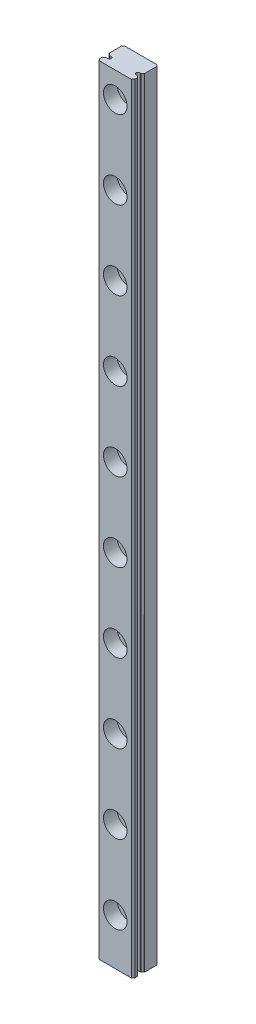
from build123d import *

# Parameters (mm, degrees)
RESSALTO_EXTRUS_O1_DEPTH                             = 1000
CORTE_EXTRUS_O1_START                                = -1000
CORTE_EXTRUS_O1_DEPTH                                = 1000
CORTE_EXTRUS_O2_DEPTH                                = 1001.031261626
CORTE_EXTRUS_O3_DEPTH                                = 1001.031261626
CORTE_EXTRUS_O4_DEPTH                                = 1001.031261626
CORTE_EXTRUS_O5_DEPTH                                = 0.002166667
CORTE_EXTRUS_O6_DEPTH                                = 0.002166667
CORTE_EXTRUS_O7_DEPTH                                = 0.002166667
CORTE_EXTRUS_O8_DEPTH                                = 0.002166667
INCLINA_O1_ANGLE                                     = 45.1469538
ESBO_O10_W                                           = 0.450000001
ESBO_O10_H                                           = 1000
REBAIXO_PARA_PARAFUSO_DE_M_QUINA_DE_CABE_D           = 3.5
REBAIXO_PARA_PARAFUSO_DE_M_QUINA_DE_CABE_CBORE_D     = 6
REBAIXO_PARA_PARAFUSO_DE_M_QUINA_DE_CABE_CBORE_DEPTH = 3.50000002
CHANFRO1_SIZE                                        = 0.062563219
CHANFRO1_SIZE2                                       = 0.062205617
CHANFRO3_START                                       = -3.730761794
CHANFRO3_DEPTH                                       = 0.399013115
CHANFRO4_SIZE                                        = 0.4
FILETE1_R                                            = 0.130000023
SKETCH1_W                                            = 36.072768502
SKETCH1_H                                            = 801.847062841
SKETCH1_W_2                                          = 21.632087489
SKETCH1_H_2                                          = 62.411000867
CUT_EXTRUDE1_DEPTH                                   = 10


with BuildPart() as part:
    # Esboço1 → Ressalto-extrusão1 (new body)
    with BuildSketch(Plane.XZ):
        with BuildLine():
            Line((4.5, 5.4097155), (4.5, 6.01167813))
            Line((4.5, 6.01167813), (4.1, 6.50000002))
            Line((4.1, 6.50000002), (-4.1, 6.50000002))
            Line((-4.1, 6.50000002), (-4.5, 6.01167813))
            Line((-4.5, 6.01167813), (-4.5, 2e-08))
            Line((-4.5, 2e-08), (4.5, 2e-08))
            Line((4.5, 2e-08), (4.5, 3.50196265))
            ThreePointArc((4.5, 3.50196265), (4.477413879, 3.553810372), (4.43494978, 3.59116167))
            ThreePointArc((4.43494978, 3.59116167), (3.930462682, 4.43021964), (4.43494978, 5.26927761))
            ThreePointArc((4.43494978, 5.26927761), (4.490651601, 5.328761203), (4.5, 5.4097155))
        make_face()
    extrude(amount=-RESSALTO_EXTRUS_O1_DEPTH)

    # Esboço2 → Corte-extrusão1 (cut)
    with BuildSketch(Plane(origin=(0, 1000, 0), x_dir=(-1, 0, 0), z_dir=(0, 1, 0)).offset(CORTE_EXTRUS_O1_START)):
        with BuildLine():
            Line((-4.030498711, 4.00588336), (-3.673447948, 4.00588336))
            ThreePointArc((-3.673447948, 4.00588336), (-3.223447946, 4.455883362), (-3.673447948, 4.905883363))
            Line((-3.673447948, 4.905883363), (-3.953580008, 4.905883363))
            ThreePointArc((-3.953580008, 4.905883363), (-4.010719931, 4.899199784), (-4.065149208, 4.917830263))
            ThreePointArc((-4.065149208, 4.917830263), (-3.93114763, 4.466290066), (-4.030498711, 4.00588336))
        make_face()
    extrude(amount=CORTE_EXTRUS_O1_DEPTH, mode=Mode.SUBTRACT)

    # Esboço3 → Corte-extrusão2 (cut, through all)
    with BuildSketch(Plane(origin=(0, 1000, 0), x_dir=(-1, 0, 0), z_dir=(0, 1, 0))):
        with BuildLine():
            Line((4.5, 4.03150278), (4.5, 4.88017535))
            Line((4.5, 4.88017535), (3.66946318, 4.88017535))
            ThreePointArc((3.66946318, 4.88017535), (3.969667593, 4.455839065), (3.66946318, 4.03150278))
            Line((3.66946318, 4.03150278), (4.5, 4.03150278))
        make_face()
    extrude(amount=-CORTE_EXTRUS_O2_DEPTH, mode=Mode.SUBTRACT)

    # Esboço4 → Corte-extrusão3 (cut, through all)
    with BuildSketch(Plane(origin=(0, 1000, 0), x_dir=(-1, 0, 0), z_dir=(0, 1, 0))):
        with BuildLine():
            Line((4.026513974, 4.88017535), (4.5, 4.88017535))
            Line((4.5, 4.88017535), (4.5, 5.328056964))
            ThreePointArc((4.5, 5.328056964), (4.223646078, 5.145991535), (4.026513974, 4.88017535))
        make_face()
    extrude(amount=-CORTE_EXTRUS_O3_DEPTH, mode=Mode.SUBTRACT)

    # Esboço5 → Corte-extrusão4 (cut, through all)
    with BuildSketch(Plane(origin=(0, 1000, 0), x_dir=(-1, 0, 0), z_dir=(0, 1, 0))):
        with BuildLine():
            Line((4.5, 3.583620931), (4.5, 4.03150278))
            Line((4.5, 4.03150278), (4.026513856, 4.03150278))
            ThreePointArc((4.026513856, 4.03150278), (4.223645982, 3.76568645), (4.5, 3.583620931))
        make_face()
    extrude(amount=-CORTE_EXTRUS_O4_DEPTH, mode=Mode.SUBTRACT)

    # Esboço6 → Corte-extrusão5 (cut)
    with BuildSketch(Plane(origin=(0, 1000, 0), x_dir=(-1, 0, 0), z_dir=(0, 1, 0))):
        Polygon((0.891369267, 3.403698133), (0.714701433, 3.168235633), (0.2187042, 2.61105), (1.0945792, 2.61105), (1.0945792, 2.695983333), (0.398689633, 2.695983333), (0.794326433, 3.149466667), (0.9743123, 3.3891), (1.067110588, 3.573407857), (0.95413722, 3.802321701), (0.7876908, 3.88505), (0.54301, 3.88505), (0.375434678, 3.803592619), (0.295011167, 3.6384023), (0.295011167, 3.562), (0.3812718, 3.562), (0.3812718, 3.631766667), (0.437672733, 3.743620833), (0.549645633, 3.800116667), (0.7802262, 3.800116667), (0.893028067, 3.743810633), (0.976240026, 3.576039029), align=None)
    extrude(amount=-CORTE_EXTRUS_O5_DEPTH, mode=Mode.SUBTRACT)

    # Esboço7 → Corte-extrusão6 (cut)
    with BuildSketch(Plane.XZ):
        Polygon((-0.214632167, 3.88505), (-0.953983333, 3.88505), (-0.953983333, 2.61105), (-0.214632167, 2.61105), (-0.214632167, 2.695983333), (-0.86905, 2.695983333), (-0.86905, 3.205583333), (-0.5123963, 3.205583333), (-0.5123963, 3.290516667), (-0.86905, 3.290516667), (-0.86905, 3.800116667), (-0.214632167, 3.800116667), align=None)
    extrude(amount=-CORTE_EXTRUS_O6_DEPTH, mode=Mode.SUBTRACT)

    # Esboço8 → Corte-extrusão7 (cut)
    with BuildSketch(Plane(origin=(0, 1000, 0), x_dir=(-1, 0, 0), z_dir=(0, 1, 0))):
        Polygon((-0.214632167, 3.88505), (-0.953983333, 3.88505), (-0.953983333, 2.61105), (-0.214632167, 2.61105), (-0.214632167, 2.695983333), (-0.86905, 2.695983333), (-0.86905, 3.205583333), (-0.5123963, 3.205583333), (-0.5123963, 3.290516667), (-0.86905, 3.290516667), (-0.86905, 3.800116667), (-0.214632167, 3.800116667), align=None)
    extrude(amount=-CORTE_EXTRUS_O7_DEPTH, mode=Mode.SUBTRACT)

    # Esboço9 → Corte-extrusão8 (cut)
    with BuildSketch(Plane.XZ):
        Polygon((0.510057167, 3.620830633), (0.6071, 3.718655633), (0.6071, 2.609403333), (0.692033333, 2.609403333), (0.692033333, 3.883403333), (0.6741176, 3.883403333), (0.6741176, 3.795069794), (0.3690544, 3.640736667), (0.3690544, 3.551253333), align=None)
    extrude(amount=-CORTE_EXTRUS_O8_DEPTH, mode=Mode.SUBTRACT)

    # Inclinação1
    inclina_o1_faces = [part.faces().sort_by_distance(p)[0] for p in [
        (0.6741176, 0.001083333, 3.839236564),
    ]]
    draft(inclina_o1_faces, Plane(origin=(0.692033333, 0.002166667, 3.883403333), x_dir=(-1, 0, 0), z_dir=(0, 0, -1)), INCLINA_O1_ANGLE)

    # Esboço10 → Corte-Revolução1 (revolve, cut)
    with BuildSketch(Plane.XY.offset(4.455839065)):
        with Locations((-3.294667591, 500)):
            Rectangle(ESBO_O10_W, ESBO_O10_H)
    revolve(axis=Axis((-3.519667591, 1000, 4.455839065), (0, -1, 0)), mode=Mode.SUBTRACT)

    # Rebaixo para parafuso de máquina de cabeça sextavada de M31 (through all)
    with Locations(Plane.XY.offset(6.50000002)):
        with Locations((0, 990), (0, 970), (0, 950), (0, 930), (0, 910), (0, 890), (0, 870), (0, 850), (0, 830), (0, 810), (0, 790), (0, 770), (0, 750), (0, 730), (0, 710), (0, 690), (0, 670), (0, 650), (0, 630), (0, 610), (0, 590), (0, 570), (0, 550), (0, 530), (0, 510), (0, 490), (0, 470), (0, 450), (0, 430), (0, 410), (0, 390), (0, 370), (0, 350), (0, 330), (0, 310), (0, 290), (0, 270), (0, 250), (0, 230), (0, 210), (0, 190), (0, 170), (0, 150), (0, 130), (0, 110), (0, 90), (0, 70), (0, 50), (0, 30), (0, 10)):
            CounterBoreHole(REBAIXO_PARA_PARAFUSO_DE_M_QUINA_DE_CABE_D / 2, REBAIXO_PARA_PARAFUSO_DE_M_QUINA_DE_CABE_CBORE_D / 2, REBAIXO_PARA_PARAFUSO_DE_M_QUINA_DE_CABE_CBORE_DEPTH)

    # Chanfro1
    chanfro1_edges = [part.edges().sort_by_distance(p)[0] for p in [
        (-0.976240026, 999.998916667, 3.576039029),
    ]]
    chanfro1_side = [part.faces().sort_by_distance(p)[0] for p in [
        (-0.933804646, 999.998916667, 3.489868581),
    ]]
    chamfer(chanfro1_edges, length=CHANFRO1_SIZE, length2=CHANFRO1_SIZE2, reference=chanfro1_side[0])

    # Chanfro3: read off the stored shape, not the designer's step
    # Chanfro3 outline → Chanfro3 (add)
    with BuildSketch(Plane(origin=(0, 0, 0), x_dir=(0.8991051825477068, 0, 0.43773264753254887), z_dir=(0.4377326475325489, 0, -0.8991051825477069)).offset(CHANFRO3_START)):
        Polygon((1.327401403, -999.997833333), (1.31122788, -999.997833333), (1.311999664, -1000), (1.327401403, -1000), align=None)
    extrude(amount=CHANFRO3_DEPTH)

    # Chanfro4
    chanfro4_edges = [part.edges().sort_by_distance(p)[0] for p in [
        (4.5, 500, 2e-08),
        (-4.5, 500, 2e-08),
    ]]
    chamfer(chanfro4_edges, length=CHANFRO4_SIZE)

    # Filete1
    filete1_edges = [part.edges().sort_by_distance(p)[0] for p in [
        (4.030498711, 500, 4.00588336),
        (-4.026513974, 500, 4.88017535),
        (-4.5, 500, 5.328056964),
        (-4.5, 500, 3.583620931),
        (-4.026513856, 500, 4.03150278),
    ]]
    fillet(filete1_edges, radius=FILETE1_R)

    # Sketch1 → Cut-Extrude1 (cut)
    with BuildSketch(Plane(origin=(0, 0, 0), x_dir=(-1, 0, 0), z_dir=(0, 0, -1))):
        with Locations((-9.39117436, 617.429605919)):
            Rectangle(SKETCH1_W, SKETCH1_H)
        with Locations((0.25600221, -13.052857141)):
            Rectangle(SKETCH1_W_2, SKETCH1_H_2)
    extrude(amount=-CUT_EXTRUDE1_DEPTH, mode=Mode.SUBTRACT)


solid = part.part
